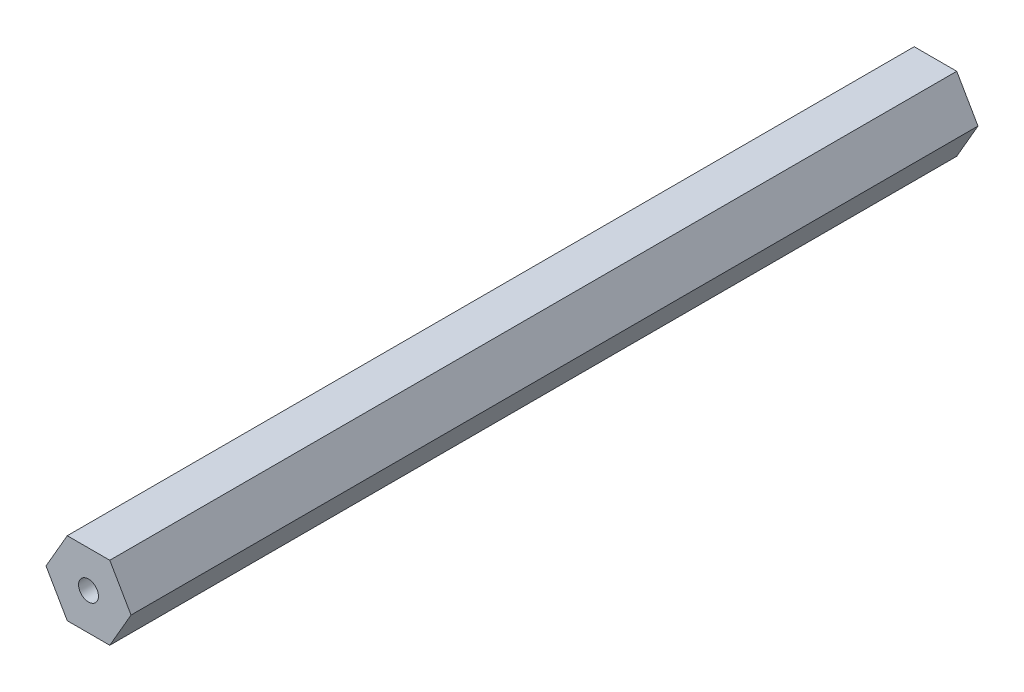
from build123d import *

# Parameters (mm, degrees)
SKETCH1_R           = 1.7145
BOSS_EXTRUDE1_DEPTH = 73.025


with BuildPart() as part:
    # Sketch1 → Boss-Extrude1 (new, symmetric)
    with BuildSketch(Plane.XY):
        Polygon((7.332348419, 0), (3.666174209, 6.35), (-3.666174209, 6.35), (-7.332348419, 0), (-3.666174209, -6.35), (3.666174209, -6.35), align=None)
        Circle(SKETCH1_R, mode=Mode.SUBTRACT)
    extrude(amount=BOSS_EXTRUDE1_DEPTH, both=True)


solid = part.part
